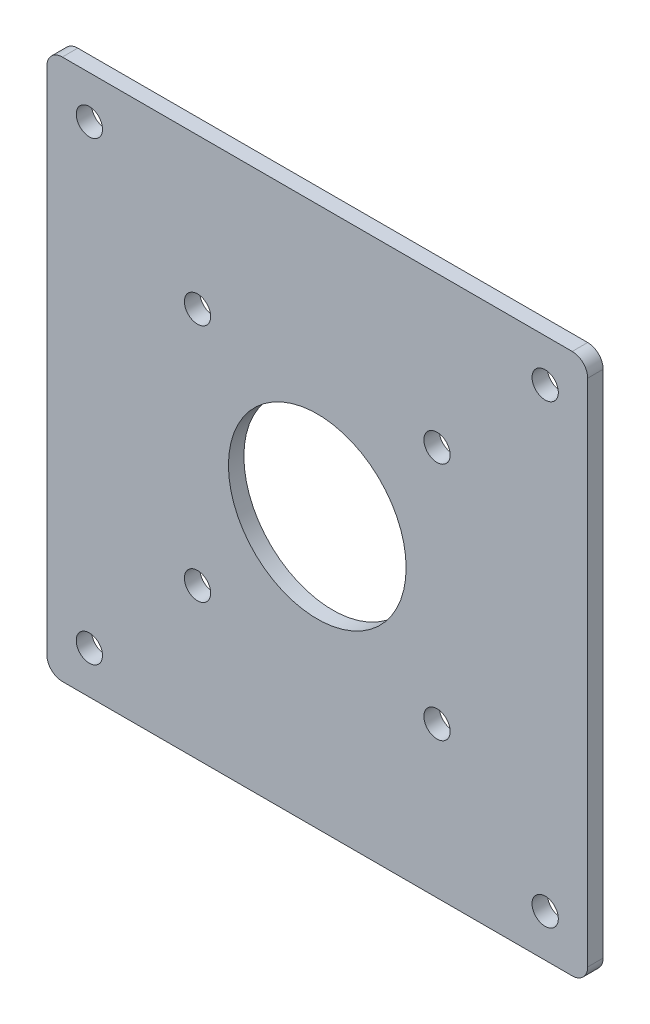
from build123d import *

# Parameters (mm, degrees)
SKIZZE1_W                        = 70
SKIZZE1_H                        = 70
AUFSATZ_LINEAR_AUSTRAGEN1_DEPTH  = 2
VERRUNDUNG2_R                    = 2
F_23_0_23_DURCHMESSER_BOHRUNG1_D = 23
DURCHGANGSLOCH_F_R_M31_D         = 3.4
DURCHGANGSLOCH_F_R_M32_D         = 3.4


with BuildPart() as part:
    # Skizze1 → Aufsatz-Linear austragen1 (new body)
    with BuildSketch(Plane.XY):
        Rectangle(SKIZZE1_W, SKIZZE1_H)
    extrude(amount=AUFSATZ_LINEAR_AUSTRAGEN1_DEPTH)

    # Verrundung2
    verrundung2_edges = [part.edges().sort_by_distance(p)[0] for p in [
        (-35, 35, 1),
        (-35, -35, 1),
        (35, -35, 1),
        (35, 35, 1),
    ]]
    fillet(verrundung2_edges, radius=VERRUNDUNG2_R)

    # Ø23.0 (23) Durchmesser Bohrung1 (through all)
    with Locations(Plane.XY.offset(2)):
        with Locations((0, 0)):
            Hole(F_23_0_23_DURCHMESSER_BOHRUNG1_D / 2)

    # Durchgangsloch für M31 (through all)
    with Locations(Plane.XY.offset(2)):
        with Locations((-15.5, 15.5), (15.5, 15.5), (15.5, -15.5), (-15.5, -15.5)):
            Hole(DURCHGANGSLOCH_F_R_M31_D / 2)

    # Durchgangsloch für M32 (through all)
    with Locations(Plane.XY.offset(2)):
        with Locations((-29.5, 29.5), (29.5, 29.5), (29.5, -29.5), (-29.5, -29.5)):
            Hole(DURCHGANGSLOCH_F_R_M32_D / 2)


solid = part.part
